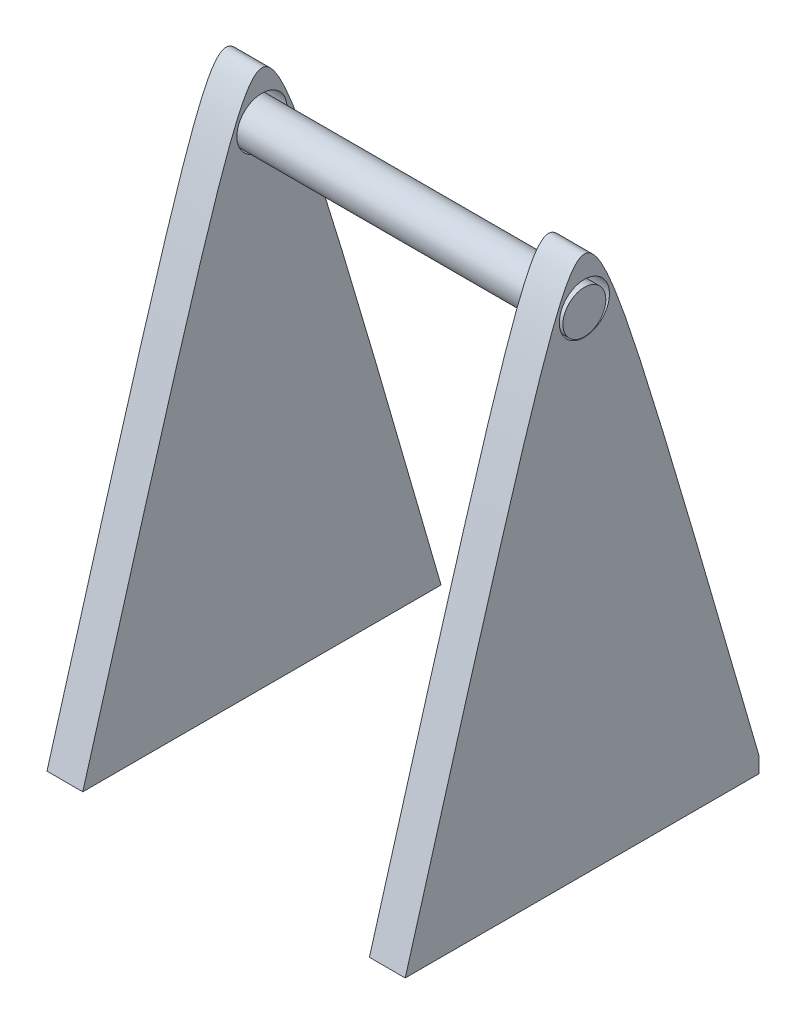
from build123d import *

# Parameters (mm, degrees)
ESBO_O1_W                  = 10
ESBO_O1_H                  = 100
RESSALTO_EXTRUS_O1_DEPTH   = 150
RESSALTO_EXTRUS_O1_2_DEPTH = 150
CORTE_EXTRUS_O1_START      = -100
CORTE_EXTRUS_O1_OUTLINE_W  = 1.245836464
CORTE_EXTRUS_O1_OUTLINE_H  = 150
CORTE_EXTRUS_O1_DEPTH      = 100
ESBO_O5_R                  = 7
CORTE_EXTRUS_O2_DEPTH      = 100
ESBO_O6_R                  = 5.983762355
RESSALTO_EXTRUS_O2_DEPTH   = 100


# Read off the part's stored shape, not the designer's step: Corte-extrusão1
with BuildPart() as part:
    # Esboço1 → Ressalto-extrusão1 (new body)
    with BuildSketch(Plane(origin=(-224.998105669, 0, -20.759462898), x_dir=(1, 0, 0), z_dir=(0, 1, 0))):
        with Locations((-1156.248974855, 0)):
            Rectangle(ESBO_O1_W, ESBO_O1_H)
    extrude(amount=RESSALTO_EXTRUS_O1_DEPTH)


with BuildPart() as body_2:
    # Esboço1 → Ressalto-extrus_o1 2 (new body)
    with BuildSketch(Plane(origin=(-224.998105669, 0, -20.759462898), x_dir=(1, 0, 0), z_dir=(0, 1, 0))):
        with Locations((-1066.248974855, -1.245836464)):
            Rectangle(ESBO_O1_W, ESBO_O1_H)
    extrude(amount=RESSALTO_EXTRUS_O1_2_DEPTH)


with BuildPart() as corte_extrus_o1_tool:
    # Corte-extrusão1 outline → Corte-extrusão1 (new body)
    with BuildSketch(Plane(origin=(-1386.247080524, 0, -20.759462898), x_dir=(0, 0, 1), z_dir=(-1, 0, 0)).offset(CORTE_EXTRUS_O1_START)):
        with BuildLine():
            Line((-48.754163536, 150), (-48.754163536, 4.331339448))
            add(Edge.make_bspline(
                [(-48.754163536, 4.331339448), (-6.841123619, 149.999999991), (-3e-09, 150)],
                knots=[0.002030015, 0.002030015, 0.002030015, 0.5, 0.5, 0.5], degree=2, weights=[1.02138966, 3.639533599, 3.639533599]))
            Line((-3e-09, 150), (-48.754163536, 150))
        make_face()
        with BuildLine():
            add(Edge.make_bspline(
                [(-50, 0), (-49.3694276, 2.192990803), (-48.754163536, 4.331339448)],
                knots=[0, 0, 0, 0.002030015, 0.002030015, 0.002030015], degree=2, weights=[1, 1.010716585, 1.02138966]))
            Line((-48.754163536, 4.331339448), (-48.754163536, 150))
            Line((-48.754163536, 150), (-50, 150))
            Line((-50, 150), (-50, 0))
        make_face()
        with BuildLine():
            Line((50, 150), (-3e-09, 150))
            add(Edge.make_bspline(
                [(-3e-09, 150), (6.869012006, 150.000000009), (50, 0)],
                knots=[0.5, 0.5, 0.5, 1, 1, 1], degree=2, weights=[3.639533599, 3.6395336, 1]))
            Line((50, 0), (50, 150))
        make_face()
        with Locations((50.622918232, 75)):
            Rectangle(CORTE_EXTRUS_O1_OUTLINE_W, CORTE_EXTRUS_O1_OUTLINE_H)
    extrude(amount=CORTE_EXTRUS_O1_DEPTH)


with BuildPart() as part_1:
    add(part.part)

    # Corte-extrusão1: cut by corte_extrus_o1_tool
    add(corte_extrus_o1_tool.part, mode=Mode.SUBTRACT)


with BuildPart() as body_2_1:
    add(body_2.part)

    # Corte-extrusão1: cut by corte_extrus_o1_tool
    add(corte_extrus_o1_tool.part, mode=Mode.SUBTRACT)


with BuildPart() as corte_extrus_o2_tool:
    # Esboço5 → Corte-extrusão2 (new body)
    with BuildSketch(Plane(origin=(-1386.247080524, 8.231771722, -20.759462898), x_dir=(0, 0, 1), z_dir=(-1, 0, 0))):
        with Locations((0, 128.643010552)):
            Circle(ESBO_O5_R)
    extrude(amount=-CORTE_EXTRUS_O2_DEPTH)


with BuildPart() as part_2:
    add(part_1.part)

    # Corte-extrusão2: cut by corte_extrus_o2_tool
    add(corte_extrus_o2_tool.part, mode=Mode.SUBTRACT)


with BuildPart() as body_2_2:
    add(body_2_1.part)

    # Corte-extrusão2: cut by corte_extrus_o2_tool
    add(corte_extrus_o2_tool.part, mode=Mode.SUBTRACT)


with BuildPart() as body_3:
    # Esboço6 → Ressalto-extrusão2 (new body)
    with BuildSketch(Plane(origin=(-1386.247080524, 0, -20.759462898), x_dir=(0, 0, 1), z_dir=(-1, 0, 0))):
        with Locations((0, 135.992086984)):
            Circle(ESBO_O6_R)
    extrude(amount=-RESSALTO_EXTRUS_O2_DEPTH)


solid = Compound([part_2.part, body_2_2.part, body_3.part])
